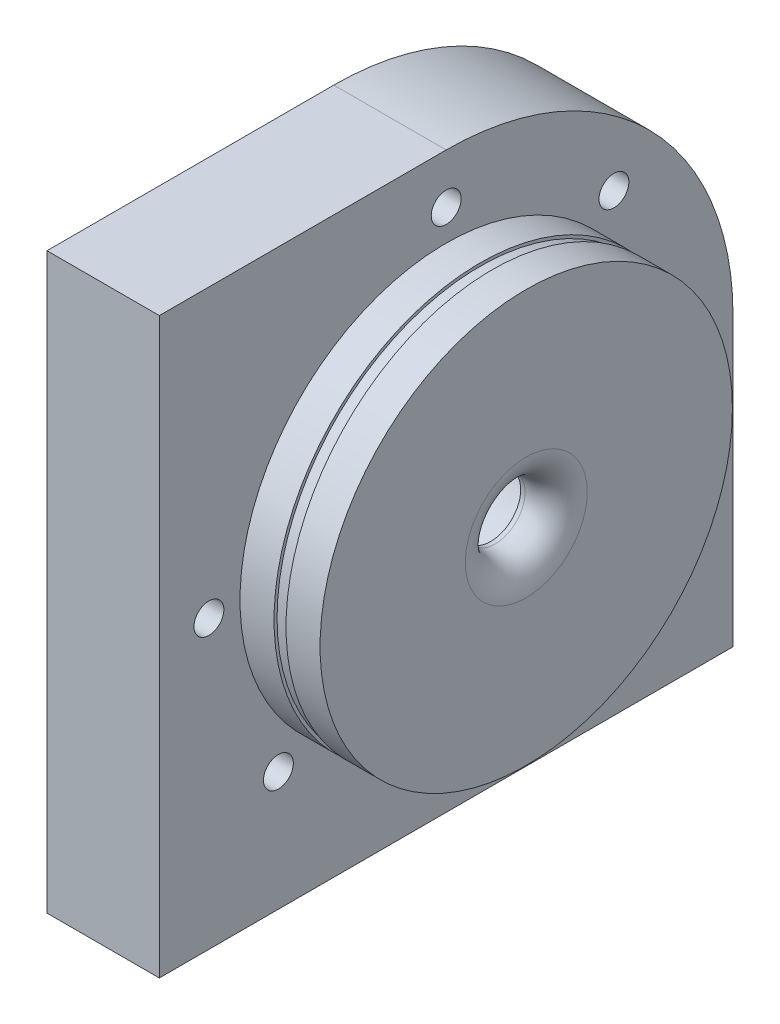
from build123d import *

# Parameters (mm, degrees)
SKETCH1_R                     = 43.815
HOUSING_FITTING_EXTRUDE_DEPTH = 17.018
HOUSING_BODY_1_DEPTH          = 23.876
SKETCH3_R                     = 6.35
IMPELLER_BORE_DEPTH           = 17.018
SKETCH4_R                     = 4
SHAFT_BORE_DEPTH              = 70.612
O_RING_CUT_DEPTH              = 1.27
O_RING_CUT_DEPTH_BACK         = 1.27
SKETCH5_R                     = 43.942
SKETCH5_R_2                   = 43.18
SKETCH12_R                    = 3.175
CUT_EXTRUDE2_DEPTH            = 32.004
CIRPATTERN1_COUNT             = 8
SKETCH14_R                    = 3.175
SKETCH14_R_2                  = 3.392842108
CUT_EXTRUDE4_DEPTH            = 16.51
SKETCH15_R                    = 3.175
CUT_EXTRUDE5_DEPTH            = 10.922
FILLET1_R                     = 6.604
SKETCH16_R                    = 12.954
CUT_EXTRUDE7_DEPTH            = 33.3629
SKETCH17_R                    = 15.24
CUT_EXTRUDE8_DEPTH            = 13.97
SKETCH20_R                    = 25.146
CUT_EXTRUDE11_DEPTH           = 6.35


with BuildPart() as part:
    # Sketch1 → Housing Fitting Extrude (new body)
    with BuildSketch(Plane(origin=(0, 0, 0), x_dir=(0, 0, -1), z_dir=(1, 0, 0))):
        Circle(SKETCH1_R)
    extrude(amount=HOUSING_FITTING_EXTRUDE_DEPTH)

    # Sketch2 → Housing Body 1 (add)
    with BuildSketch(Plane.ZY):
        with BuildLine():
            Line((60.96, 0), (60.96, 60.96))
            Line((60.96, 60.96), (0, 60.96))
            ThreePointArc((0, 60.96), (-43.105229381, 43.105229381), (-60.96, 0))
            Line((-60.96, 0), (-60.96, -54.61))
            Line((-60.96, -54.61), (-60.96, -60.96))
            Line((-60.96, -60.96), (60.96, -60.96))
            Line((60.96, -60.96), (60.96, -54.61))
            Line((60.96, -54.61), (60.96, 0))
        make_face()
    extrude(amount=HOUSING_BODY_1_DEPTH)

    # Sketch3 → Impeller Bore (cut)
    with BuildSketch(Plane(origin=(17.018, 0, 0), x_dir=(0, 0, -1), z_dir=(1, 0, 0))):
        Circle(SKETCH3_R)
    extrude(amount=-IMPELLER_BORE_DEPTH, mode=Mode.SUBTRACT)

    # Sketch4 → Shaft Bore (cut)
    with BuildSketch(Plane(origin=(0, 0, 0), x_dir=(0, 0, -1), z_dir=(1, 0, 0))):
        Circle(SKETCH4_R)
    extrude(amount=-SHAFT_BORE_DEPTH, mode=Mode.SUBTRACT)

    # Sketch5 → O-Ring Cut (cut, two sides: drawn at the far end of the back side and taken through both)
    with BuildSketch(Plane(origin=(8.509, 0, 0), x_dir=(0, 0, -1), z_dir=(1, 0, 0)).offset(-O_RING_CUT_DEPTH_BACK)):
        Circle(SKETCH5_R)
        Circle(SKETCH5_R_2, mode=Mode.SUBTRACT)
    extrude(amount=O_RING_CUT_DEPTH + O_RING_CUT_DEPTH_BACK, mode=Mode.SUBTRACT)

    # Sketch12 → Cut-Extrude2 (cut)
    with BuildSketch(Plane(origin=(0, 0, 0), x_dir=(0, 0, -1), z_dir=(1, 0, 0))):
        with Locations((-50.419, 0)):
            Circle(SKETCH12_R)
    cut_extrude2 = extrude(amount=-CUT_EXTRUDE2_DEPTH, mode=Mode.SUBTRACT)

    # CirPattern1: Cut-Extrude2 ×8 about axis, 1 skipped
    cirpattern1_axis = Axis((0, 0, 0), (1, 0, 0))
    add([cut_extrude2.rotate(cirpattern1_axis, i * 360 / CIRPATTERN1_COUNT) for i in range(1, CIRPATTERN1_COUNT) if i not in (7,)], mode=Mode.SUBTRACT)

    # Sketch14 → Cut-Extrude4 (cut)
    with BuildSketch(Plane.XZ.offset(60.96)):
        with Locations((-9.525, -46.754349092)):
            Circle(SKETCH14_R)
        with Locations((-9.525, 41.914080666)):
            Circle(SKETCH14_R_2)
    extrude(amount=-CUT_EXTRUDE4_DEPTH, mode=Mode.SUBTRACT)

    # Sketch15 → Cut-Extrude5 (cut)
    with BuildSketch(Plane(origin=(0, 0, -60.96), x_dir=(-1, 0, 0), z_dir=(0, 0, -1))):
        with Locations((9.525, -39.337514031)):
            Circle(SKETCH15_R)
    extrude(amount=-CUT_EXTRUDE5_DEPTH, mode=Mode.SUBTRACT)

    # Fillet1
    fillet1_edges = [part.edges().sort_by_distance(p)[0] for p in [
        (17.018, 0, 6.35),
    ]]
    fillet(fillet1_edges, radius=FILLET1_R)

    # Sketch16 → Cut-Extrude7 (cut)
    with BuildSketch(Plane.ZY.offset(23.876)):
        Circle(SKETCH16_R)
    extrude(amount=-CUT_EXTRUDE7_DEPTH, mode=Mode.SUBTRACT)

    # Sketch17 → Cut-Extrude8 (cut)
    with BuildSketch(Plane.ZY.offset(23.876)):
        Circle(SKETCH17_R)
    extrude(amount=-CUT_EXTRUDE8_DEPTH, mode=Mode.SUBTRACT)

    # Sketch20 → Cut-Extrude11 (cut)
    with BuildSketch(Plane.ZY.offset(23.876)):
        Circle(SKETCH20_R)
    extrude(amount=-CUT_EXTRUDE11_DEPTH, mode=Mode.SUBTRACT)


solid = part.part
